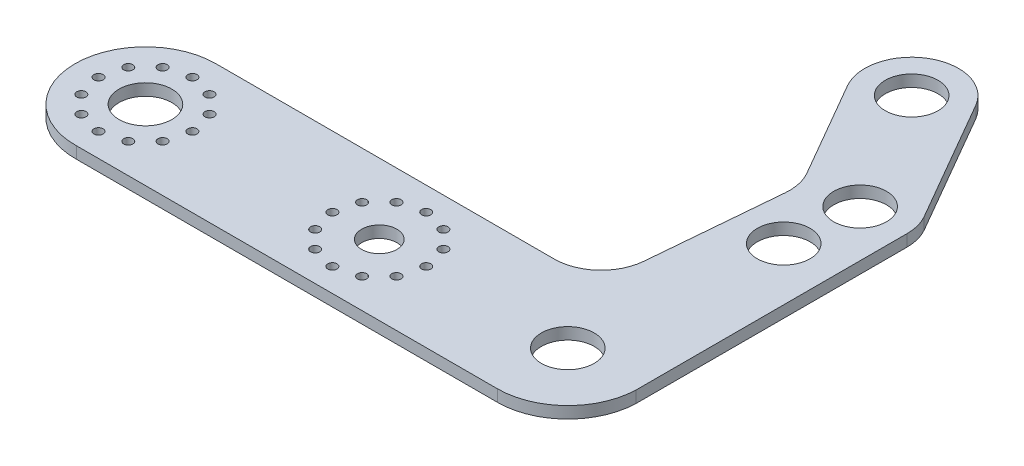
from build123d import *

# Parameters (mm, degrees)
BOSS_EXTRUDE1_OUTLINE_R   = 2.4892
BOSS_EXTRUDE1_OUTLINE_R_2 = 14.2875
BOSS_EXTRUDE1_DEPTH       = 6.35
FILLET1_R                 = 25.4
FILLET2_R                 = 25.4
SKETCH2_R                 = 9.525
SKETCH2_R_2               = 2.4892
CUT_EXTRUDE1_DEPTH        = 7.366


# Read off the part's stored shape, not the designer's step: Boss-Extrude1
with BuildPart() as part:
    # Boss-Extrude1 outline → Boss-Extrude1 (new body)
    with BuildSketch(Plane(origin=(0, 0, 0), x_dir=(1, 0, 0), z_dir=(0, 1, 0))):
        with BuildLine():
            Line((206.436572843, 38.103184831), (0, 38.103184831))
            ThreePointArc((0, 38.103184831), (-38.101592382, -0.348356423), (0.696683728, -38.096815169))
            Line((0.696683728, -38.096815169), (228.6, -38.09681517))
            ThreePointArc((228.6, -38.09681517), (255.149948273, -27.321558755), (266.68118702, -1.091110092))
            Line((266.68118702, -1.091110092), (266.729096059, 145.494235656))
            ThreePointArc((266.729096059, 145.494235656), (265.863612052, 152.068239358), (263.326141338, 158.194235572))
            Line((263.326141338, 158.194235572), (225.226141484, 224.185371425))
            ThreePointArc((225.226141484, 224.185371425), (190.529096228, 233.482416681), (181.232050972, 198.785371425))
            Line((181.232050972, 198.785371425), (215.327756353, 139.729877384))
            Line((215.327756353, 139.729877384), (206.436572843, 38.103184831))
        make_face()
        with Locations((-12.7, -21.997045256)):
            Circle(BOSS_EXTRUDE1_OUTLINE_R, mode=Mode.SUBTRACT)
        with Locations((0, -25.4)):
            Circle(BOSS_EXTRUDE1_OUTLINE_R, mode=Mode.SUBTRACT)
        with Locations((-21.997045256, -12.7)):
            Circle(BOSS_EXTRUDE1_OUTLINE_R, mode=Mode.SUBTRACT)
        with Locations((12.7, -21.997045256)):
            Circle(BOSS_EXTRUDE1_OUTLINE_R, mode=Mode.SUBTRACT)
        with Locations((21.997045256, -12.7)):
            Circle(BOSS_EXTRUDE1_OUTLINE_R, mode=Mode.SUBTRACT)
        with Locations((-25.4, 0)):
            Circle(BOSS_EXTRUDE1_OUTLINE_R, mode=Mode.SUBTRACT)
        with Locations((-21.997045256, 12.7)):
            Circle(BOSS_EXTRUDE1_OUTLINE_R, mode=Mode.SUBTRACT)
        Circle(BOSS_EXTRUDE1_OUTLINE_R_2, mode=Mode.SUBTRACT)
        with Locations((-12.7, 21.997045256)):
            Circle(BOSS_EXTRUDE1_OUTLINE_R, mode=Mode.SUBTRACT)
        with Locations((0, 25.4)):
            Circle(BOSS_EXTRUDE1_OUTLINE_R, mode=Mode.SUBTRACT)
        with Locations((25.4, 0)):
            Circle(BOSS_EXTRUDE1_OUTLINE_R, mode=Mode.SUBTRACT)
        with Locations((21.997045256, 12.7)):
            Circle(BOSS_EXTRUDE1_OUTLINE_R, mode=Mode.SUBTRACT)
        with Locations((12.7, 21.997045256)):
            Circle(BOSS_EXTRUDE1_OUTLINE_R, mode=Mode.SUBTRACT)
        with Locations((228.6, 0)):
            Circle(BOSS_EXTRUDE1_OUTLINE_R_2, mode=Mode.SUBTRACT)
        with Locations((238.001821162, 107.463307623)):
            Circle(BOSS_EXTRUDE1_OUTLINE_R_2, mode=Mode.SUBTRACT)
        with Locations((241.329096228, 145.494235656)):
            Circle(BOSS_EXTRUDE1_OUTLINE_R_2, mode=Mode.SUBTRACT)
        with Locations((203.229096228, 211.485371425)):
            Circle(BOSS_EXTRUDE1_OUTLINE_R_2, mode=Mode.SUBTRACT)
    extrude(amount=BOSS_EXTRUDE1_DEPTH)

    # Fillet1
    fillet1_edges = [part.edges().sort_by_distance(p)[0] for p in [
        (215.327756353, 3.175, -139.729877384),
    ]]
    fillet(fillet1_edges, radius=FILLET1_R)

    # Fillet2
    fillet2_edges = [part.edges().sort_by_distance(p)[0] for p in [
        (206.436572843, 3.175, -38.103184831),
    ]]
    fillet(fillet2_edges, radius=FILLET2_R)

    # Sketch2 → Cut-Extrude1 (cut)
    with BuildSketch(Plane(origin=(0, 6.35, 0), x_dir=(1, 0, 0), z_dir=(0, 1, 0))):
        with Locations(Location((126.571094876, 0, 0), (0, 0, 270))):
            Circle(SKETCH2_R)
        with Locations(Location((101.171094876, 0, 0), (0, 0, 270))):
            Circle(SKETCH2_R_2)
        with Locations(Location((104.57404962, 12.7, 0), (0, 0, 270))):
            Circle(SKETCH2_R_2)
        with Locations(Location((113.871094876, 21.997045256, 0), (0, 0, 270))):
            Circle(SKETCH2_R_2)
        with Locations(Location((126.571094876, 25.4, 0), (0, 0, 270))):
            Circle(SKETCH2_R_2)
        with Locations(Location((139.271094876, 21.997045256, 0), (0, 0, 270))):
            Circle(SKETCH2_R_2)
        with Locations(Location((148.568140132, 12.7, 0), (0, 0, 270))):
            Circle(SKETCH2_R_2)
        with Locations(Location((151.971094876, 0, 0), (0, 0, 270))):
            Circle(SKETCH2_R_2)
        with Locations(Location((148.568140132, -12.7, 0), (0, 0, 270))):
            Circle(SKETCH2_R_2)
        with Locations(Location((139.271094876, -21.997045256, 0), (0, 0, 270))):
            Circle(SKETCH2_R_2)
        with Locations(Location((126.571094876, -25.4, 0), (0, 0, 270))):
            Circle(SKETCH2_R_2)
        with Locations(Location((113.871094876, -21.997045256, 0), (0, 0, 270))):
            Circle(SKETCH2_R_2)
        with Locations(Location((104.57404962, -12.7, 0), (0, 0, 270))):
            Circle(SKETCH2_R_2)
    extrude(amount=-CUT_EXTRUDE1_DEPTH, mode=Mode.SUBTRACT)


solid = part.part
